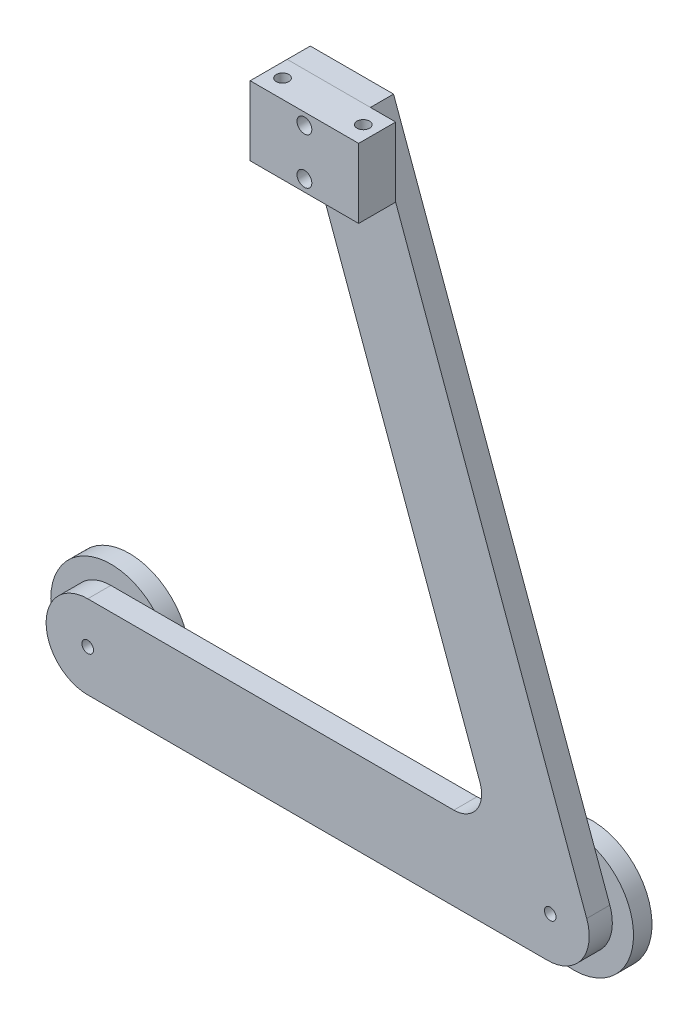
from build123d import *

# Parameters (mm, degrees)
SKETCH_1_R          = 1.25
EXTRUDE_1_DEPTH     = 5
SKETCH_2_W          = 23.459553514
SKETCH_2_H          = 15
EXTRUDE_2_DEPTH     = 8
SKETCH_3_R          = 1.6
CUT_EXTRUDE_1_DEPTH = 157.667782704
SKETCH_4_R          = 1.35
CUT_EXTRUDE_2_DEPTH = 160.025582655
SKETCH_6_R          = 3
SKETCH_6_R_2        = 1.25
EXTRUDE_3_DEPTH     = 5
EXTRUDE_3_2_DEPTH   = 5
SKETCH_7_R          = 13
SKETCH_7_R_2        = 3
EXTRUDE_4_DEPTH     = 4
EXTRUDE_4_2_DEPTH   = 4


with BuildPart() as part:
    # ｽｹｯﾁ1 → ﾎﾞｽ - 押し出し1 (new body)
    with BuildSketch(Plane.XY):
        with BuildLine():
            Line((-44.607087957, 122.55696691), (-2.930732316, 8.05212086))
            ThreePointArc((-2.930732316, 8.05212086), (-3.653975775, 2.558541382), (-8.56888804, 0))
            Line((-8.56888804, 0), (-87.724267892, 0))
            ThreePointArc((-87.724267892, 0), (-94.088228922, -2.636038969), (-96.724267892, -9))
            ThreePointArc((-96.724267892, -9), (-94.088228922, -15.363961031), (-87.724267892, -18))
            Line((-87.724267892, -18), (11.698132156, -18))
            ThreePointArc((11.698132156, -18), (19.070500555, -14.162187927), (20.155365743, -5.92181871))
            Line((20.155365743, -5.92181871), (-26.607087957, 122.55696691))
            Line((-26.607087957, 122.55696691), (-44.607087957, 122.55696691))
        make_face()
        with Locations((12.275732108, -9)):
            Circle(SKETCH_1_R, mode=Mode.SUBTRACT)
        with Locations((-87.724267892, -9)):
            Circle(SKETCH_1_R, mode=Mode.SUBTRACT)
    extrude(amount=EXTRUDE_1_DEPTH)


with BuildPart() as body_2:
    # ｽｹｯﾁ2 → ﾎﾞｽ - 押し出し2 (new body)
    with BuildSketch(Plane.XY.offset(5)):
        with Locations((-32.8773112, 115.05696691)):
            Rectangle(SKETCH_2_W, SKETCH_2_H)
    extrude(amount=EXTRUDE_2_DEPTH)


with BuildPart() as cut_extrude_1_tool:
    # ｽｹｯﾁ3 → ｶｯﾄ - 押し出し1 (new, through all)
    with BuildSketch(Plane.XY.offset(13)):
        with Locations((-32.8773112, 120.05696691)):
            Circle(SKETCH_3_R)
        with Locations((-32.8773112, 110.05696691)):
            Circle(SKETCH_3_R)
    extrude(amount=-CUT_EXTRUDE_1_DEPTH)


with BuildPart() as part_1:
    add(part.part)

    # ｶｯﾄ - 押し出し1: cut by cut_extrude_1_tool
    add(cut_extrude_1_tool.part, mode=Mode.SUBTRACT)


with BuildPart() as body_2_1:
    add(body_2.part)

    # ｶｯﾄ - 押し出し1: cut by cut_extrude_1_tool
    add(cut_extrude_1_tool.part, mode=Mode.SUBTRACT)

    # ｽｹｯﾁ4 → ｶｯﾄ - 押し出し2 (cut, through all)
    with BuildSketch(Plane.XZ.offset(-107.55696691)):
        with Locations((-24.147534443, 9)):
            Circle(SKETCH_4_R)
        with Locations((-41.607087957, 9)):
            Circle(SKETCH_4_R)
    extrude(amount=-CUT_EXTRUDE_2_DEPTH, mode=Mode.SUBTRACT)


with BuildPart() as body_3:
    # ｽｹｯﾁ6 → ﾎﾞｽ - 押し出し3 (new body)
    with BuildSketch(Plane(origin=(0, 0, 0), x_dir=(-1, 0, 0), z_dir=(0, 0, -1))):
        with Locations((-12.275732108, -9)):
            Circle(SKETCH_6_R)
        with Locations((-12.275732108, -9)):
            Circle(SKETCH_6_R_2, mode=Mode.SUBTRACT)
    extrude(amount=EXTRUDE_3_DEPTH)


with BuildPart() as body_4:
    # ｽｹｯﾁ6 → Extrude 3 2 (new body)
    with BuildSketch(Plane(origin=(0, 0, 0), x_dir=(-1, 0, 0), z_dir=(0, 0, -1))):
        with Locations((87.724267892, -9)):
            Circle(SKETCH_6_R)
        with Locations((87.724267892, -9)):
            Circle(SKETCH_6_R_2, mode=Mode.SUBTRACT)
    extrude(amount=EXTRUDE_3_2_DEPTH)


with BuildPart() as body_5:
    # ｽｹｯﾁ7 → ﾎﾞｽ - 押し出し4 (new body)
    with BuildSketch(Plane(origin=(0, 0, 0), x_dir=(-1, 0, 0), z_dir=(0, 0, -1))):
        with Locations((-12.275732108, -9)):
            Circle(SKETCH_7_R)
        with Locations((-12.275732108, -9)):
            Circle(SKETCH_7_R_2, mode=Mode.SUBTRACT)
    extrude(amount=EXTRUDE_4_DEPTH)


with BuildPart() as body_6:
    # ｽｹｯﾁ7 → Extrude 4 2 (new body)
    with BuildSketch(Plane(origin=(0, 0, 0), x_dir=(-1, 0, 0), z_dir=(0, 0, -1))):
        with Locations((87.724267892, -9)):
            Circle(SKETCH_7_R)
        with Locations((87.724267892, -9)):
            Circle(SKETCH_7_R_2, mode=Mode.SUBTRACT)
    extrude(amount=EXTRUDE_4_2_DEPTH)


solid = Compound([part_1.part, body_2_1.part, body_3.part, body_4.part, body_5.part, body_6.part])
